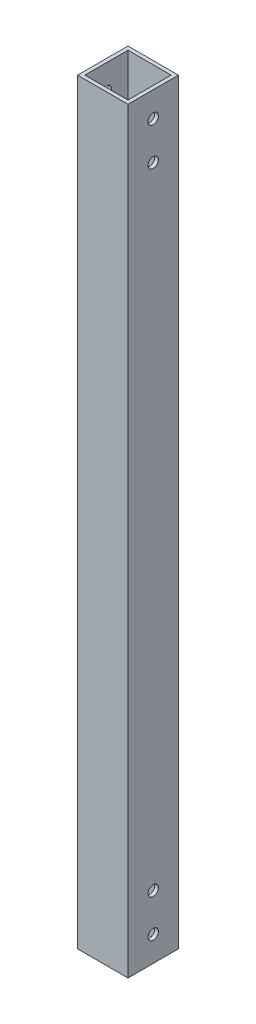
from build123d import *

# Parameters (mm, degrees)
SKETCH1_W           = 20
SKETCH1_H           = 20
SKETCH1_W_2         = 17.1
SKETCH1_H_2         = 17.1
BOSS_EXTRUDE1_DEPTH = 300
SKETCH2_R           = 2.05
CUT_EXTRUDE1_DEPTH  = 302.330383466


with BuildPart() as part:
    # Sketch1 → Boss-Extrude1 (new body)
    with BuildSketch(Plane(origin=(0, 0, 0), x_dir=(1, 0, 0), z_dir=(0, 1, 0))):
        with Locations((10, 10)):
            Rectangle(SKETCH1_W, SKETCH1_H)
        with Locations((10, 10)):
            Rectangle(SKETCH1_W_2, SKETCH1_H_2, mode=Mode.SUBTRACT)
    extrude(amount=BOSS_EXTRUDE1_DEPTH)

    # Sketch2 → Cut-Extrude1 (cut, through all)
    with BuildSketch(Plane.ZY):
        with Locations((-10, 290)):
            Circle(SKETCH2_R)
        with Locations((-10, 275)):
            Circle(SKETCH2_R)
        with Locations((-10, 25)):
            Circle(SKETCH2_R)
        with Locations((-10, 10)):
            Circle(SKETCH2_R)
    extrude(amount=-CUT_EXTRUDE1_DEPTH, mode=Mode.SUBTRACT)


solid = part.part
